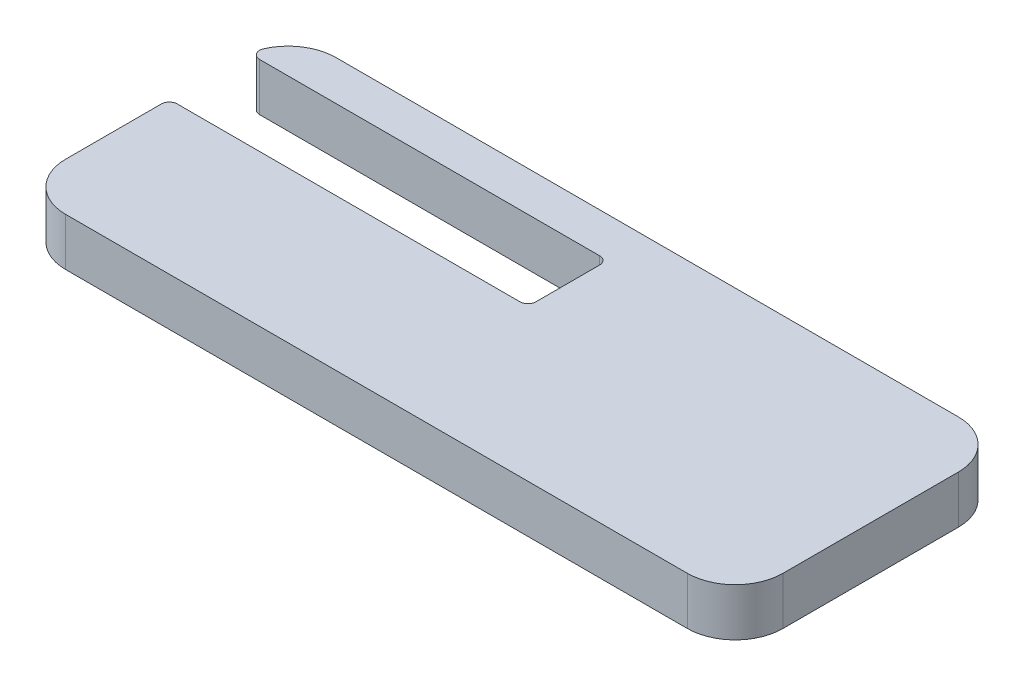
from build123d import *

# Parameters (mm, degrees)
CROQUIS1_W              = 45
CROQUIS1_H              = 17
SALIENTE_EXTRUIR1_DEPTH = 3
CROQUIS2_W              = 22.5
CROQUIS2_H              = 5
CORTAR_EXTRUIR1_DEPTH   = 3
REDONDEO1_R             = 3
REDONDEO4_R             = 0.5


with BuildPart() as part:
    # Croquis1 → Saliente-Extruir1 (new body)
    with BuildSketch(Plane(origin=(0, 0, 0), x_dir=(1, 0, 0), z_dir=(0, 1, 0))):
        with Locations((0, 1.429847209)):
            Rectangle(CROQUIS1_W, CROQUIS1_H)
    extrude(amount=SALIENTE_EXTRUIR1_DEPTH)

    # Croquis2 → Cortar-Extruir1 (cut)
    with BuildSketch(Plane(origin=(0, 3, 0), x_dir=(1, 0, 0), z_dir=(0, 1, 0))):
        with Locations((-11.25, 4.929847209)):
            Rectangle(CROQUIS2_W, CROQUIS2_H)
    extrude(amount=-CORTAR_EXTRUIR1_DEPTH, mode=Mode.SUBTRACT)

    # Redondeo1
    # the kernel refuses this fillet: 3 mm, written as the material it takes off along each edge
    with BuildSketch(Plane(origin=(-22.5, -7.395099729, -9.929847209), x_dir=(1, 0, 0), z_dir=(0, 1, 0))) as redondeo1_piece_1:
        with BuildLine():
            CenterArc((2.958039892, -3), REDONDEO1_R, 90, 80.405931773)
            Line((0, -2.5), (-0.059160798, -2.49))
            ThreePointArc((-0.059160798, -2.49), (-0.06, -1.25), (-0.06, 0))
            Line((-0.06, 0), (0, 0.06))
            Line((0, 0.06), (2.958039892, 0.06))
            Line((2.958039892, 0.06), (2.958039892, 0))
        make_face()
    extrude(amount=17.790199458, mode=Mode.SUBTRACT)
    with BuildSketch(Plane(origin=(22.5, -7.5, -9.929847209), x_dir=(-1, 0, 0), z_dir=(0, 1, 0)), Plane(origin=(22.5, -7.5, 7.070152791), x_dir=(0, 0, -1), z_dir=(0, 1, 0)), Plane(origin=(-22.5, -7.5, 7.070152791), x_dir=(1, 0, 0), z_dir=(0, 1, 0))) as redondeo1_piece_2:
        with BuildLine():
            CenterArc((REDONDEO1_R, REDONDEO1_R), REDONDEO1_R, 180, 90)
            Line((0, REDONDEO1_R), (-REDONDEO1_R * 0.02, REDONDEO1_R))
            Line((-REDONDEO1_R * 0.02, REDONDEO1_R), (-REDONDEO1_R * 0.02, -REDONDEO1_R * 0.02))
            Line((-REDONDEO1_R * 0.02, -REDONDEO1_R * 0.02), (REDONDEO1_R, -REDONDEO1_R * 0.02))
            Line((REDONDEO1_R, -REDONDEO1_R * 0.02), (REDONDEO1_R, 0))
        make_face()
    extrude(amount=18, mode=Mode.SUBTRACT)

    # Redondeo4
    redondeo4_edges = [part.edges().sort_by_distance(p)[0] for p in [
        (-22.5, 1.5, -2.429847209),
        (-22.5, 1.5, -7.429847209),
        (0, 1.5, -7.429847209),
        (0, 1.5, -2.429847209),
    ]]
    fillet(redondeo4_edges, radius=REDONDEO4_R)


solid = part.part
